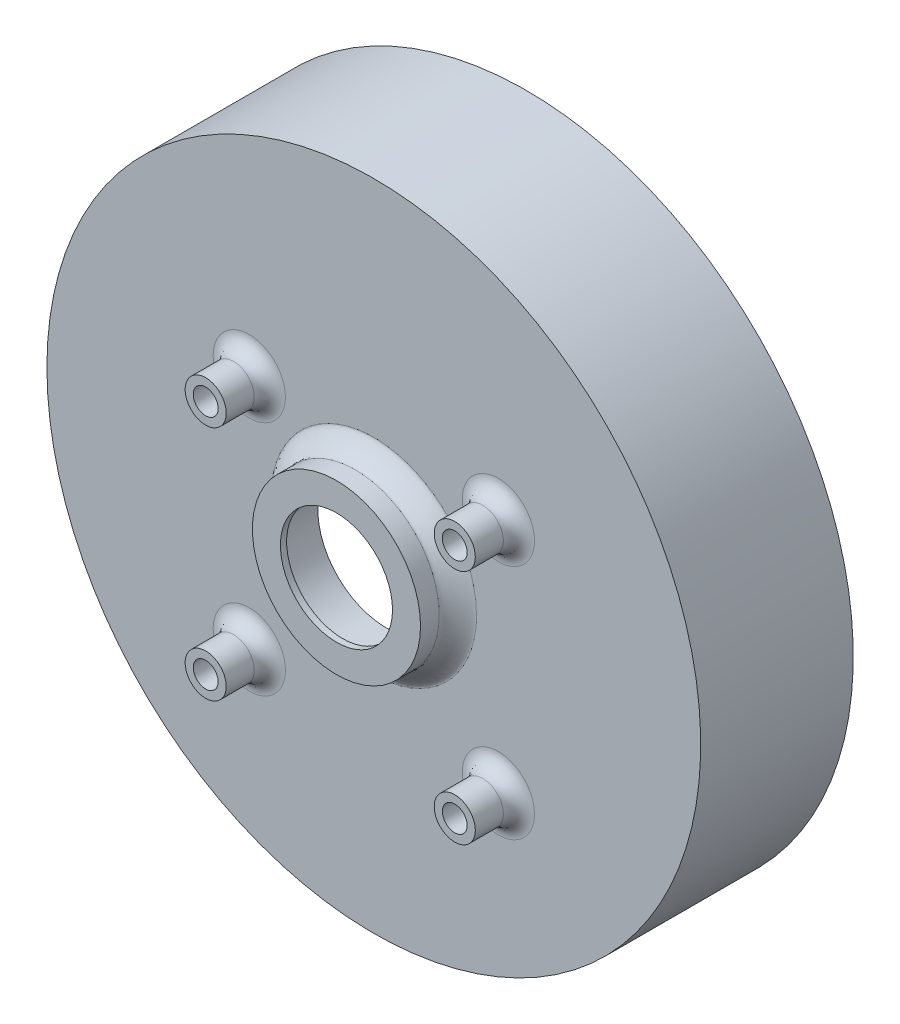
from build123d import *

# Parameters (mm, degrees)
SKETCH1_R           = 52.5
SKETCH1_R_2         = 45
BOSS_EXTRUDE1_DEPTH = 22.5
BOSS_EXTRUDE2_START = 22.5
SKETCH1_2_R         = 52.5
SKETCH1_2_R_2       = 11
BOSS_EXTRUDE2_DEPTH = 2
SKETCH3_R           = 3.3
SKETCH3_R_2         = 2
BOSS_EXTRUDE3_DEPTH = 7
FILLET1_R           = 2.5
SKETCH4_R           = 13.5
SKETCH4_R_2         = 11
BOSS_EXTRUDE4_DEPTH = 6
BOSS_EXTRUDE5_START = -7
SKETCH5_R           = 11
SKETCH5_R_2         = 9
BOSS_EXTRUDE5_DEPTH = 1
SKETCH7_R           = 2.1
CUT_EXTRUDE1_DEPTH  = 10
FILLET2_SIZE        = 3


with BuildPart() as part:
    # Sketch1 → Boss-Extrude1 (new body)
    with BuildSketch(Plane.XY):
        with Locations(Location((0, 0, 0), (0, 0, 180))):
            Circle(SKETCH1_R)
        with Locations(Location((0, 0, 0), (0, 0, 180))):
            Circle(SKETCH1_R_2, mode=Mode.SUBTRACT)
    extrude(amount=BOSS_EXTRUDE1_DEPTH)

    # Sketch1<2> → Boss-Extrude2 (add)
    with BuildSketch(Plane.XY.offset(BOSS_EXTRUDE2_START)):
        with Locations(Location((0, 0, 0), (0, 0, 180))):
            Circle(SKETCH1_2_R)
        Circle(SKETCH1_2_R_2, mode=Mode.SUBTRACT)
    extrude(amount=BOSS_EXTRUDE2_DEPTH)

    # Sketch3 → Boss-Extrude3 (add)
    # profile 1 of 4: a face of its own
    with BuildSketch(Plane.XY.offset(24.5)):
        with Locations((-20, 15)):
            Circle(SKETCH3_R)
        with Locations((-20, 15)):
            Circle(SKETCH3_R_2, mode=Mode.SUBTRACT)
    # profile 2 of 4: a face of its own
    with BuildSketch(Plane.XY.offset(24.5)):
        with Locations((20, 15)):
            Circle(SKETCH3_R)
        with Locations((20, 15)):
            Circle(SKETCH3_R_2, mode=Mode.SUBTRACT)
    # profile 3 of 4: a face of its own
    with BuildSketch(Plane.XY.offset(24.5)):
        with Locations((20, -23)):
            Circle(SKETCH3_R)
        with Locations((20, -23)):
            Circle(SKETCH3_R_2, mode=Mode.SUBTRACT)
    # profile 4 of 4: a face of its own
    with BuildSketch(Plane.XY.offset(24.5)):
        with Locations((-20, -23)):
            Circle(SKETCH3_R)
        with Locations((-20, -23)):
            Circle(SKETCH3_R_2, mode=Mode.SUBTRACT)
    extrude(amount=BOSS_EXTRUDE3_DEPTH)

    # Fillet1
    fillet1_edges = [part.edges().sort_by_distance(p)[0] for p in [
        (-23.3, 15, 24.5),
        (16.7, 15, 24.5),
        (16.7, -23, 24.5),
        (-23.3, -23, 24.5),
    ]]
    fillet(fillet1_edges, radius=FILLET1_R)

    # Sketch4 → Boss-Extrude4 (add)
    with BuildSketch(Plane.XY.offset(24.5)):
        Circle(SKETCH4_R)
        Circle(SKETCH4_R_2, mode=Mode.SUBTRACT)
    extrude(amount=BOSS_EXTRUDE4_DEPTH)

    # Sketch5 → Boss-Extrude5 (add)
    with BuildSketch(Plane(origin=(0, 0, 22.5), x_dir=(-1, 0, 0), z_dir=(0, 0, -1)).offset(BOSS_EXTRUDE5_START)):
        with Locations(Location((0, 0, 0), (0, 0, 180))):
            Circle(SKETCH5_R)
        with Locations(Location((0, 0, 0), (0, 0, 180))):
            Circle(SKETCH5_R_2, mode=Mode.SUBTRACT)
    extrude(amount=-BOSS_EXTRUDE5_DEPTH)

    # Sketch7 → Cut-Extrude1 (cut)
    with BuildSketch(Plane(origin=(0, 0, 0), x_dir=(-1, 0, 0), z_dir=(0, 0, -1))):
        with Locations((-34.471455583, 34.471455583)):
            Circle(SKETCH7_R)
        with Locations((34.471455583, 34.471455583)):
            Circle(SKETCH7_R)
        with Locations((34.471455583, -34.471455583)):
            Circle(SKETCH7_R)
        with Locations((-34.471455583, -34.471455583)):
            Circle(SKETCH7_R)
    extrude(amount=-CUT_EXTRUDE1_DEPTH, mode=Mode.SUBTRACT)

    # Fillet2
    # a fillet whose section is not a circle: 3 mm, written as the material it adds along each edge
    with BuildSketch(Plane(origin=(0, 0, 24.5), x_dir=(1, 0, 0), z_dir=(0, -1, 0))) as fillet2_piece_1:
        with BuildLine():
            Bezier((13.5 + FILLET2_SIZE, 0), (13.5, 0), (13.5, FILLET2_SIZE), weights=[1, 0.212132034, 1])
            Line((13.5, FILLET2_SIZE), (13.5, 0))
            Line((13.5, 0), (13.5 + FILLET2_SIZE, 0))
        make_face()
    revolve(axis=Axis((0, 0, 24.5), (0, 0, 1)))


solid = part.part
